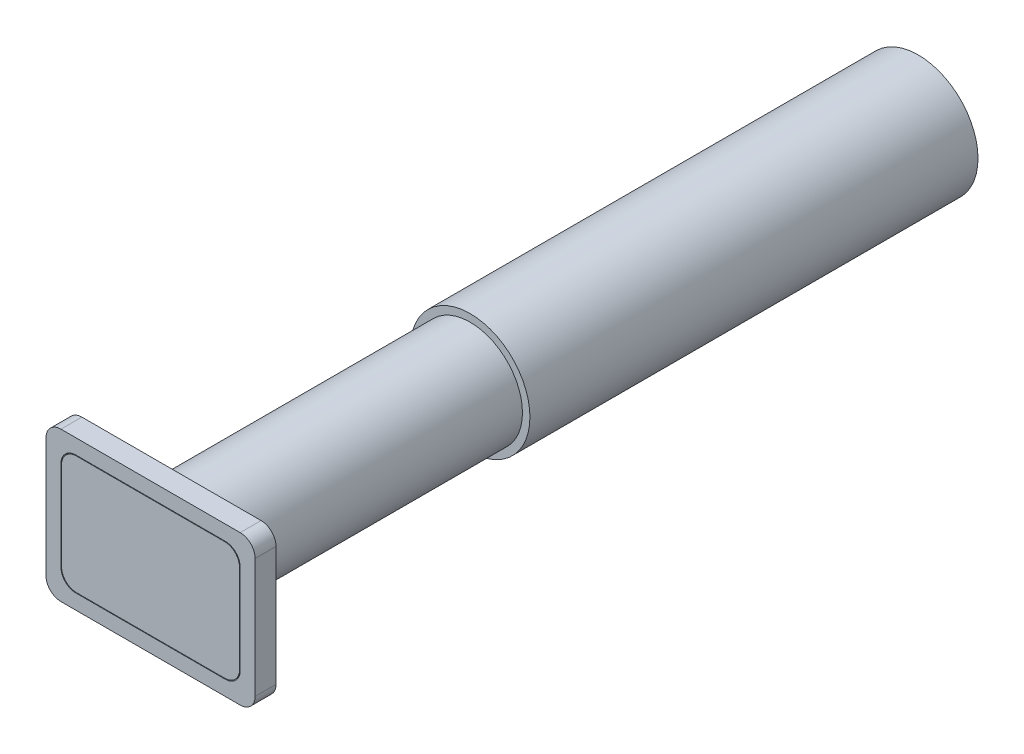
from build123d import *

# Parameters (mm, degrees)
SKETCH1_R           = 25.4
BOSS_EXTRUDE1_DEPTH = 190.5
SKETCH2_R           = 22.225
BOSS_EXTRUDE2_DEPTH = 127
BOSS_EXTRUDE3_DEPTH = 8.89
CUT_EXTRUDE1_DEPTH  = 6.35
BOSS_EXTRUDE5_DEPTH = 6.096


with BuildPart() as part:
    # Sketch1 → Boss-Extrude1 (new body)
    with BuildSketch(Plane.XY):
        Circle(SKETCH1_R)
    extrude(amount=BOSS_EXTRUDE1_DEPTH)

    # Sketch2 → Boss-Extrude2 (add)
    with BuildSketch(Plane.XY.offset(190.5)):
        Circle(SKETCH2_R)
    extrude(amount=BOSS_EXTRUDE2_DEPTH)

    # Sketch3 → Boss-Extrude3 (add)
    with BuildSketch(Plane.XY.offset(317.5)):
        with BuildLine():
            Line((-38.1, 31.75), (38.1, 31.75))
            ThreePointArc((38.1, 31.75), (42.590128061, 29.890128061), (44.45, 25.4))
            Line((44.45, 25.4), (44.45, -25.4))
            ThreePointArc((44.45, -25.4), (42.590128061, -29.890128061), (38.1, -31.75))
            Line((38.1, -31.75), (-38.1, -31.75))
            ThreePointArc((-38.1, -31.75), (-42.590128061, -29.890128061), (-44.45, -25.4))
            Line((-44.45, -25.4), (-44.45, 25.4))
            ThreePointArc((-44.45, 25.4), (-42.590128061, 29.890128061), (-38.1, 31.75))
        make_face()
    extrude(amount=BOSS_EXTRUDE3_DEPTH)

    # Sketch4 → Cut-Extrude1 (cut)
    with BuildSketch(Plane.XY.offset(326.39)):
        with BuildLine():
            Line((-31.75, -25.4), (31.75, -25.4))
            ThreePointArc((31.75, -25.4), (36.240128061, -23.540128061), (38.1, -19.05))
            Line((38.1, -19.05), (38.1, 19.05))
            ThreePointArc((38.1, 19.05), (36.240128061, 23.540128061), (31.75, 25.4))
            Line((31.75, 25.4), (-31.75, 25.4))
            ThreePointArc((-31.75, 25.4), (-36.240128061, 23.540128061), (-38.1, 19.05))
            Line((-38.1, 19.05), (-38.1, -19.05))
            ThreePointArc((-38.1, -19.05), (-36.240128061, -23.540128061), (-31.75, -25.4))
        make_face()
    extrude(amount=-CUT_EXTRUDE1_DEPTH, mode=Mode.SUBTRACT)


with BuildPart() as body_2:
    # Sketch5 → Boss-Extrude5 (new body)
    with BuildSketch(Plane.XY.offset(320.294)):
        with BuildLine():
            Line((-31.496, 25.146), (31.496, 25.146))
            ThreePointArc((31.496, 25.146), (35.986128061, 23.286128061), (37.846, 18.796))
            Line((37.846, 18.796), (37.846, -18.796))
            ThreePointArc((37.846, -18.796), (35.986128061, -23.286128061), (31.496, -25.146))
            Line((31.496, -25.146), (-31.496, -25.146))
            ThreePointArc((-31.496, -25.146), (-35.986128061, -23.286128061), (-37.846, -18.796))
            Line((-37.846, -18.796), (-37.846, 18.796))
            ThreePointArc((-37.846, 18.796), (-35.986128061, 23.286128061), (-31.496, 25.146))
        make_face()
    extrude(amount=BOSS_EXTRUDE5_DEPTH)


solid = Compound([part.part, body_2.part])
